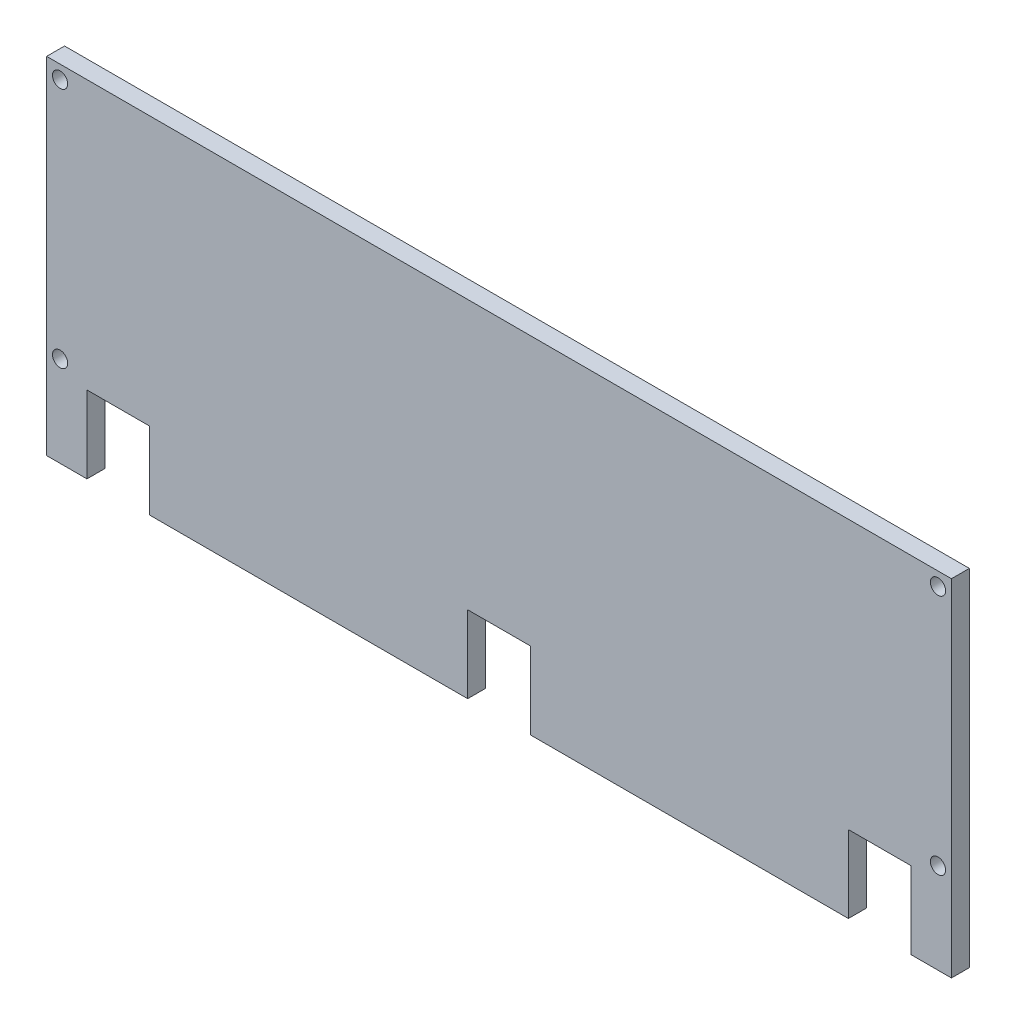
from build123d import *

# Parameters (mm, degrees)
IZIM1_W                   = 505
IZIM1_H                   = 150
TABAN_FLAN_1_DEPTH        = 10
IZIM6_R                   = 4.25
KES_EKSTR_ZYON1_DEPTH     = 264.592962729
AYNALAMA2_COPY_1_SKETCH_R = 4.25
AYNALAMA2_COPY_1_DEPTH    = 264.592962729
IZIM7_W                   = 22.5
IZIM7_H                   = 43
IZIM7_W_2                 = 177.5
SEKME1_DEPTH              = 10


# Sheet-metal steps are written as plain solids
with BuildPart() as part:
    # Çizim1 → Taban-Flanş1 (new body)
    with BuildSketch(Plane.XY):
        Rectangle(IZIM1_W, IZIM1_H)
    extrude(amount=-TABAN_FLAN_1_DEPTH)

    # Çizim6 → Kes-Ekstrüzyon1 (cut, through all)
    with BuildSketch(Plane(origin=(0, 0, -10), x_dir=(-1, 0, 0), z_dir=(0, 0, -1))):
        with Locations((245, -67.5)):
            Circle(IZIM6_R)
    kes_ekstr_zyon1 = extrude(amount=-KES_EKSTR_ZYON1_DEPTH, mode=Mode.SUBTRACT)

    # Aynalama1: Kes-Ekstrüzyon1 across plane
    add(kes_ekstr_zyon1.mirror(Plane(origin=(0, 0, 0), x_dir=(0, 0, 1), z_dir=(1, 0, 0))), mode=Mode.SUBTRACT)

    # Aynalama2: Kes-Ekstrüzyon1 across plane
    add(kes_ekstr_zyon1.mirror(Plane.ZX), mode=Mode.SUBTRACT)

    # Aynalama2 copy 1 sketch → Aynalama2 copy 1 (cut, through all)
    with BuildSketch(Plane(origin=(0, 0, -10), x_dir=(1, 0, 0), z_dir=(0, 0, -1))):
        with Locations((245, -67.5)):
            Circle(AYNALAMA2_COPY_1_SKETCH_R)
    extrude(amount=-AYNALAMA2_COPY_1_DEPTH, mode=Mode.SUBTRACT)

    # Çizim7 → Sekme1 (add)
    with BuildSketch(Plane.XY):
        with Locations((-241.25, -96.5)):
            Rectangle(IZIM7_W, IZIM7_H)
        with Locations((-106.25, -96.5)):
            Rectangle(IZIM7_W_2, IZIM7_H)
        with Locations((106.25, -96.5)):
            Rectangle(IZIM7_W_2, IZIM7_H)
        with Locations((241.25, -96.5)):
            Rectangle(IZIM7_W, IZIM7_H)
    extrude(amount=-SEKME1_DEPTH)


solid = part.part
